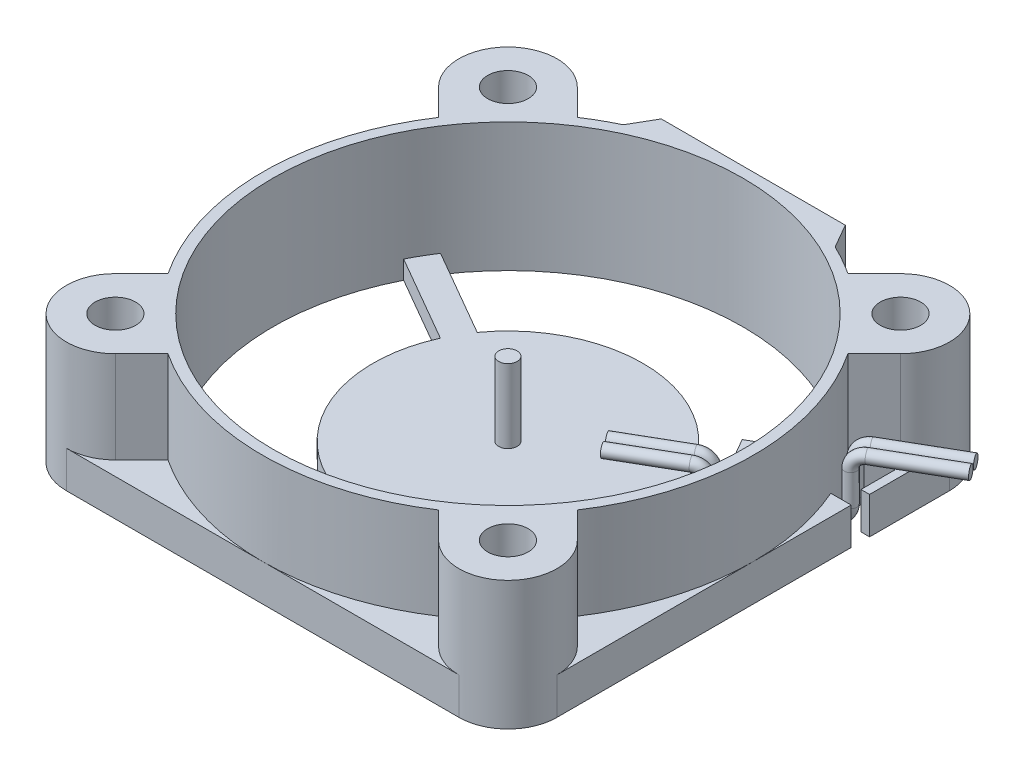
from build123d import *

# Parameters (mm, degrees)
SKETCH1_R           = 1.65
SKETCH1_R_2         = 19.15
BOSS_EXTRUDE1_DEPTH = 3
SKETCH2_R           = 1.65
SKETCH2_R_2         = 19.15
BOSS_EXTRUDE2_DEPTH = 7.5
BOSS_EXTRUDE3_DEPTH = 1.5
CUT_EXTRUDE1_DEPTH  = 31.170349683
CUT_EXTRUDE2_DEPTH  = 1.1
CUT_EXTRUDE3_REACH  = 32.17
SKETCH7_R           = 0.75
BOSS_EXTRUDE4_DEPTH = 6
BOSS_EXTRUDE5_START = 3
BOSS_EXTRUDE5_DEPTH = 7.5
DRAFT1_ANGLE        = 30
BOSS_EXTRUDE6_DEPTH = 0.2
SKETCH13_R          = 0.5


# Read off the part's stored shape, not the designer's step: Boss-Extrude5
with BuildPart() as part:
    # Sketch1 → Boss-Extrude1 (new body)
    with BuildSketch(Plane(origin=(0, 0, 0), x_dir=(1, 0, 0), z_dir=(0, 1, 0))):
        with BuildLine():
            Line((-16, -20), (16, -20))
            ThreePointArc((16, -20), (18.828427125, -18.828427125), (20, -16))
            Line((20, -16), (20, 16))
            ThreePointArc((20, 16), (18.828427125, 18.828427125), (16, 20))
            Line((16, 20), (-16, 20))
            ThreePointArc((-16, 20), (-18.828427125, 18.828427125), (-20, 16))
            Line((-20, 16), (-20, -16))
            ThreePointArc((-20, -16), (-18.828427125, -18.828427125), (-16, -20))
        make_face()
        with Locations(Location((-16, 16, 0), (0, 0, 270))):
            Circle(SKETCH1_R, mode=Mode.SUBTRACT)
        with Locations(Location((16, 16, 0), (0, 0, 270))):
            Circle(SKETCH1_R, mode=Mode.SUBTRACT)
        with Locations(Location((-16, -16, 0), (0, 0, 90))):
            Circle(SKETCH1_R, mode=Mode.SUBTRACT)
        with Locations(Location((16, -16, 0), (0, 0, 90))):
            Circle(SKETCH1_R, mode=Mode.SUBTRACT)
        with Locations(Location((0, 0, 0), (0, 0, 270))):
            Circle(SKETCH1_R_2, mode=Mode.SUBTRACT)
    extrude(amount=BOSS_EXTRUDE1_DEPTH)

    # Sketch2 → Boss-Extrude2 (add)
    with BuildSketch(Plane(origin=(0, 3, 0), x_dir=(1, 0, 0), z_dir=(0, 1, 0))):
        with BuildLine():
            Line((-13.171572875, -18.828427125), (-11.027979336, -16.684833585))
            ThreePointArc((-11.027979336, -16.684833585), (0, -20), (11.027979336, -16.684833585))
            Line((11.027979336, -16.684833585), (13.171572875, -18.828427125))
            ThreePointArc((13.171572875, -18.828427125), (18.828427125, -18.828427125), (18.828427125, -13.171572875))
            Line((18.828427125, -13.171572875), (16.684833585, -11.027979336))
            ThreePointArc((16.684833585, -11.027979336), (20, 0), (16.684833585, 11.027979336))
            Line((16.684833585, 11.027979336), (18.828427125, 13.171572875))
            ThreePointArc((18.828427125, 13.171572875), (18.828427125, 18.828427125), (13.171572875, 18.828427125))
            Line((13.171572875, 18.828427125), (11.027979336, 16.684833585))
            ThreePointArc((11.027979336, 16.684833585), (0, 20), (-11.027979336, 16.684833585))
            Line((-11.027979336, 16.684833585), (-13.171572875, 18.828427125))
            ThreePointArc((-13.171572875, 18.828427125), (-18.828427125, 18.828427125), (-18.828427125, 13.171572875))
            Line((-18.828427125, 13.171572875), (-16.684833585, 11.027979336))
            ThreePointArc((-16.684833585, 11.027979336), (-20, 0), (-16.684833585, -11.027979336))
            Line((-16.684833585, -11.027979336), (-18.828427125, -13.171572875))
            ThreePointArc((-18.828427125, -13.171572875), (-18.828427125, -18.828427125), (-13.171572875, -18.828427125))
        make_face()
        with Locations(Location((-16, -16, 0), (0, 0, 90))):
            Circle(SKETCH2_R, mode=Mode.SUBTRACT)
        with Locations(Location((0, 0, 0), (0, 0, 270))):
            Circle(SKETCH2_R_2, mode=Mode.SUBTRACT)
        with Locations(Location((16, -16, 0), (0, 0, 90))):
            Circle(SKETCH2_R, mode=Mode.SUBTRACT)
        with Locations(Location((-16, 16, 0), (0, 0, 270))):
            Circle(SKETCH2_R, mode=Mode.SUBTRACT)
        with Locations(Location((16, 16, 0), (0, 0, 270))):
            Circle(SKETCH2_R, mode=Mode.SUBTRACT)
    extrude(amount=BOSS_EXTRUDE2_DEPTH)

    # Sketch3 → Boss-Extrude3 (add)
    with BuildSketch(Plane.XZ):
        with BuildLine():
            Line((1.1, 10.944861808), (1.1, 19.118381208))
            ThreePointArc((1.1, 19.118381208), (0, 19.15), (-1.1, 19.118381208))
            Line((-1.1, 19.118381208), (-1.1, 10.944861808))
            ThreePointArc((-1.1, 10.944861808), (-9.526279442, 5.5), (-10.028528367, -4.51980296))
            Line((-10.028528367, -4.51980296), (-17.107003805, -8.60656266))
            ThreePointArc((-17.107003805, -8.60656266), (-16.584386482, -9.575), (-16.007003805, -10.511818548))
            Line((-16.007003805, -10.511818548), (-8.928528367, -6.425058848))
            ThreePointArc((-8.928528367, -6.425058848), (-1.306256139, -10.922165303), (7.161552454, -8.349381202))
            Line((7.161552454, -8.349381202), (14.455356261, -12.560460794))
            ThreePointArc((14.455356261, -12.560460794), (16.584386482, -9.575), (18.105356261, -6.238475346))
            Line((18.105356261, -6.238475346), (10.811552454, -2.027395754))
            ThreePointArc((10.811552454, -2.027395754), (8.805744547, 6.592333651), (1.1, 10.944861808))
        make_face()
    extrude(amount=-BOSS_EXTRUDE3_DEPTH)

    # Sketch4 → Cut-Extrude1 (cut, through all)
    with BuildSketch(Plane.XZ):
        with BuildLine():
            Line((7.161552454, -8.349381202), (9.433330249, -9.660992724))
            Line((9.433330249, -9.660992724), (12.083330249, -5.071058084))
            Line((12.083330249, -5.071058084), (10.243499084, -4.008831065))
            ThreePointArc((10.243499084, -4.008831065), (8.969060633, -6.368355468), (7.161552454, -8.349381202))
        make_face()
    extrude(amount=-CUT_EXTRUDE1_DEPTH, mode=Mode.SUBTRACT)

    # Sketch5 → Cut-Extrude2 (cut)
    with BuildSketch(Plane.XZ):
        with BuildLine():
            Line((9.933330249, -8.79496732), (12.083330249, -5.071058084))
            Line((12.083330249, -5.071058084), (17.105356261, -7.970526154))
            Line((17.105356261, -7.970526154), (18.338605882, -7.980948208))
            ThreePointArc((18.338605882, -7.980948208), (17.220814787, -10.170719645), (15.842793248, -12.206797373))
            Line((15.842793248, -12.206797373), (9.933330249, -8.79496732))
        make_face()
    extrude(amount=-CUT_EXTRUDE2_DEPTH, mode=Mode.SUBTRACT)

    # Sketch6 → Cut-Extrude3 (cut, up to next)
    with BuildSketch(Plane.XZ, mode=Mode.PRIVATE) as cut_extrude3_sk1:
        with BuildLine():
            Line((18.828427125, -13.171572875), (16.684833585, -11.027979336))
            ThreePointArc((16.684833585, -11.027979336), (17.577867553, -9.540365417), (18.338605882, -7.980948208))
            Line((18.338605882, -7.980948208), (20, -7.980948208))
            Line((20, -7.980948208), (20, -9.480717324))
            Line((20, -9.480717324), (19.3, -9.480717324))
            Line((19.3, -9.480717324), (19.3, -12.206797373))
            Line((19.3, -12.206797373), (18.828427125, -13.171572875))
        make_face()
    cut_extrude3_tool1 = extrude(cut_extrude3_sk1.sketch, amount=-CUT_EXTRUDE3_REACH, mode=Mode.PRIVATE) & part.part
    add(cut_extrude3_tool1.solids().sort_by_distance((18.505479, 0, -10.298583))[0], mode=Mode.SUBTRACT)

    # Sketch7 → Boss-Extrude4 (add)
    with BuildSketch(Plane(origin=(0, 1.5, 0), x_dir=(1, 0, 0), z_dir=(0, 1, 0))):
        with Locations(Location((0, 0, 0), (0, 0, 90))):
            Circle(SKETCH7_R)
    extrude(amount=BOSS_EXTRUDE4_DEPTH)

    # Boss-Extrude5 outline → Boss-Extrude5 (add)
    with BuildSketch(Plane(origin=(0, 0, 0), x_dir=(1, 0, 0), z_dir=(0, 1, 0)).offset(BOSS_EXTRUDE5_START)):
        with BuildLine():
            Line((7.5, 20), (3.8e-08, 20))
            ThreePointArc((3.8e-08, 20), (3.820345268, 19.631733546), (7.5, 18.540496218))
            Line((7.5, 18.540496218), (7.5, 20))
        make_face()
        with BuildLine():
            Line((3.8e-08, 20), (-7.5, 20))
            Line((-7.5, 20), (-7.5, 18.540496218))
            ThreePointArc((-7.5, 18.540496218), (-3.820345231, 19.631733554), (3.8e-08, 20))
        make_face()
    extrude(amount=BOSS_EXTRUDE5_DEPTH)

    # Draft1
    draft1_faces = [part.faces().sort_by_distance(p)[0] for p in [
        (-7.5, 6.75, -19.270248109),
        (7.5, 6.75, -19.270248109),
    ]]
    draft(draft1_faces, Plane(origin=(-16, 3, -20), x_dir=(-1, 0, 0), z_dir=(0, 0, -1)), DRAFT1_ANGLE)

    # Sketch10 → Boss-Extrude6 (add)
    with BuildSketch(Plane(origin=(0, 0, -20), x_dir=(-1, 0, 0), z_dir=(0, 0, -1))):
        Polygon((-2.258183583, 2.862476447), (1.741816417, 2.862476447), (1.741816417, 3.512476447), (3.741816417, 2.162476447), (1.741816417, 0.812476447), (1.741816417, 1.462476447), (-2.258183583, 1.462476447), align=None)
        Polygon((4.868622576, 6.871113473), (4.868622576, 2.871113473), (4.218622576, 2.871113473), (5.568622576, 0.871113473), (6.918622576, 2.871113473), (6.268622576, 2.871113473), (6.268622576, 6.871113473), align=None)
    extrude(amount=BOSS_EXTRUDE6_DEPTH)


with BuildPart() as body_2:
    # Sweep4: sweep along a path in Sketch12
    with BuildLine(Plane(origin=(0.325, 0, 0.562916512), x_dir=(-0.8660254037844383, 0, 0.5000000000000009), z_dir=(-0.5000000000000008, 0, -0.8660254037844382))) as sweep4_path:
        Line((-27.796974616, 4.848053251), (-21.622447811, 4.848053251))
        ThreePointArc((-21.622447811, 4.848053251), (-20.91534103, 4.555160032), (-20.622447811, 3.848053251))
        Line((-20.622447811, 3.848053251), (-20.622447811, 1.297445707))
        ThreePointArc((-20.622447811, 1.297445707), (-20.329554592, 0.590338926), (-19.622447811, 0.297445707))
        Line((-19.622447811, 0.297445707), (-13.122492971, 0.297445707))
        ThreePointArc((-13.122492971, 0.297445707), (-12.41538619, 0.590338926), (-12.122492971, 1.297445707))
        Line((-12.122492971, 1.297445707), (-12.122492971, 1.393069256))
        ThreePointArc((-12.122492971, 1.393069256), (-11.829599752, 2.100176037), (-11.122492971, 2.393069256))
        Line((-11.122492971, 2.393069256), (-5.825995326, 2.393069256))
    # Sketch13 → Sweep4 (sweep)
    with BuildSketch(Plane(origin=(5.045459955, 0, -2.912997663), x_dir=(0.4999999999999999, 0, 0.8660254037844387), z_dir=(-0.8660254037844388, 0, 0.49999999999999994))):
        with Locations((0.65, 2.393069256)):
            Circle(SKETCH13_R)
        with Locations((-0.45, 2.393069256)):
            Circle(SKETCH13_R)
    sweep(path=sweep4_path.line)


solid = Compound([part.part, body_2.part])
